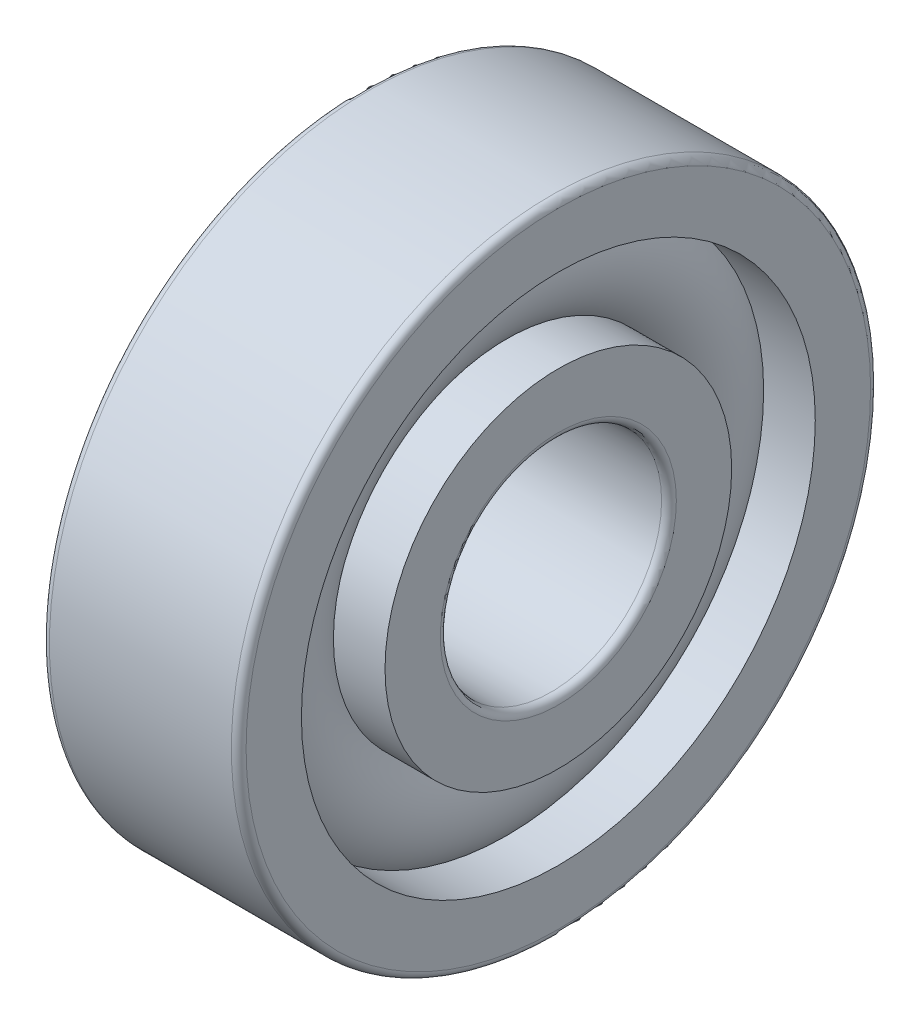
from build123d import *

# Parameters (mm, degrees)
CAGSPISKE_W     = 0.51
CAGSPISKE_H     = 0.85
CAGESPINE_ANGLE = 0.001
BALSIMSKE_R     = 2.55


with BuildPart() as part:
    # CagSpiSke → CageSpine (revolve)
    with BuildSketch(Plane.XY):
        with Locations((0, 8.75)):
            Rectangle(CAGSPISKE_W, CAGSPISKE_H)
    revolve(axis=Axis((-20.6375, 0, 0), (-1, 0, 0)), revolution_arc=CAGESPINE_ANGLE)

    # BalSimSke → BallsSimplified (revolve)
    with BuildSketch(Plane.XY):
        with Locations((0, 8.75)):
            Circle(BALSIMSKE_R)
    revolve(axis=Axis((-10, 0, 0), (1, 0, 0)))

    # InnRacSke → InnerRace (revolve)
    with BuildSketch(Plane.XY):
        with BuildLine():
            Line((-1.86698286, 7.05), (-4, 7.05))
            Line((-4, 7.05), (-4, 4.8))
            ThreePointArc((-4, 4.8), (-3.912132034, 4.587867966), (-3.7, 4.5))
            Line((-3.7, 4.5), (3.7, 4.5))
            ThreePointArc((3.7, 4.5), (3.912132034, 4.587867966), (4, 4.8))
            Line((4, 4.8), (4, 7.05))
            Line((4, 7.05), (1.86698286, 7.05))
            ThreePointArc((1.86698286, 7.05), (0, 6.225), (-1.86698286, 7.05))
        make_face()
    revolve(axis=Axis((-20.6375, 0, 0), (1, 0, 0)))

    # OutRacSke → OuterRace (revolve)
    with BuildSketch(Plane.XY):
        with BuildLine():
            Line((-1.86698286, 10.45), (-4, 10.45))
            Line((-4, 10.45), (-4, 12.7))
            ThreePointArc((-4, 12.7), (-3.912132034, 12.912132034), (-3.7, 13))
            Line((-3.7, 13), (3.7, 13))
            ThreePointArc((3.7, 13), (3.912132034, 12.912132034), (4, 12.7))
            Line((4, 12.7), (4, 10.45))
            Line((4, 10.45), (1.86698286, 10.45))
            ThreePointArc((1.86698286, 10.45), (0, 11.275), (-1.86698286, 10.45))
        make_face()
    revolve(axis=Axis((-20.6375, 0, 0), (1, 0, 0)))


solid = part.part
